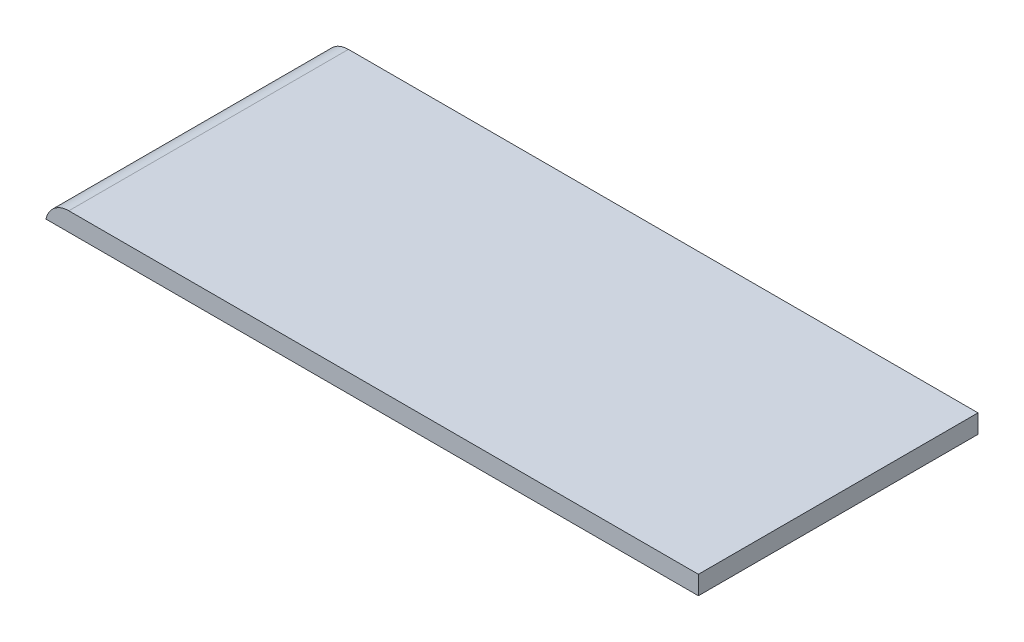
from build123d import *

# Parameters (mm, degrees)
SKETCH_1_W      = 70
SKETCH_1_H      = 30
EXTRUDE_1_DEPTH = 2
FILLET_1_R      = 2.5


with BuildPart() as part:
    # Эскиз1 → Бобышка-Вытянуть1 (new body)
    with BuildSketch(Plane(origin=(0, 0, 0), x_dir=(1, 0, 0), z_dir=(0, 1, 0))):
        with Locations((-45.606740844, -34.497792834)):
            Rectangle(SKETCH_1_W, SKETCH_1_H)
    extrude(amount=EXTRUDE_1_DEPTH)

    # Скругление1
    # the kernel refuses this fillet: 2.5 mm, written as the material it takes off along each edge
    with BuildSketch(Plane(origin=(-80.606740844, 2, 13.374068477), x_dir=(1.591615728102107e-12, -1.0, 0), z_dir=(0, 0, 1))) as fillet_1_piece_1:
        with BuildLine():
            CenterArc((2.5, 2.449489743), FILLET_1_R, 180, 78.463040967)
            Line((0, 2.449489743), (-0.05, 2.449489743))
            Line((-0.05, 2.449489743), (-0.05, 0))
            Line((-0.05, 0), (0, -0.05))
            ThreePointArc((0, -0.05), (1, -0.05), (1.99, -0.048989795))
            Line((1.99, -0.048989795), (2, 0))
        make_face()
    extrude(amount=42.247448714, mode=Mode.SUBTRACT)


solid = part.part
